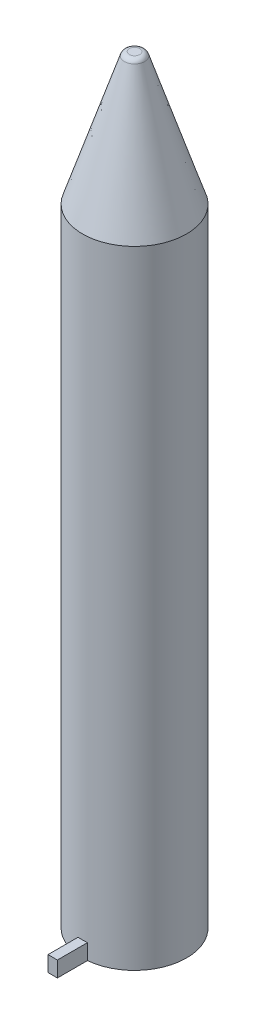
from build123d import *

# Parameters (mm, degrees)
SKETCH1_R           = 10
BOSS_EXTRUDE1_DEPTH = 120.65
BOSS_EXTRUDE2_DEPTH = 3
SKETCH4_R           = 8
CUT_EXTRUDE1_DEPTH  = 2.54


with BuildPart() as part:
    # Sketch1 → Boss-Extrude1 (new body)
    with BuildSketch(Plane(origin=(0, 0, 0), x_dir=(1, 0, 0), z_dir=(0, 1, 0))):
        Circle(SKETCH1_R)
    extrude(amount=BOSS_EXTRUDE1_DEPTH)

    # Sketch2 → Revolve1 (revolve)
    with BuildSketch(Plane.XY):
        with BuildLine():
            Line((0, 120.65), (0, 146.05))
            Line((0, 146.05), (1, 146.05))
            ThreePointArc((1, 146.05), (1.587481775, 145.859237397), (1.950824444, 145.359730328))
            Line((1.950824444, 145.359730328), (10, 120.65))
            Line((10, 120.65), (0, 120.65))
        make_face()
    revolve(axis=Axis((0, 120.65, 0), (0, 1, 0)))

    # Sketch3 → Boss-Extrude2 (add)
    with BuildSketch(Plane.XZ):
        with BuildLine():
            Line((-0.9, 15.75), (0.9, 15.75))
            Line((0.9, 15.75), (0.9, 9.354806465))
            ThreePointArc((0.9, 9.354806465), (0, 9.398), (-0.9, 9.354806465))
            Line((-0.9, 9.354806465), (-0.9, 15.75))
        make_face()
    extrude(amount=-BOSS_EXTRUDE2_DEPTH)

    # Sketch4 → Cut-Extrude1 (cut)
    with BuildSketch(Plane.XZ):
        Circle(SKETCH4_R)
    extrude(amount=-CUT_EXTRUDE1_DEPTH, mode=Mode.SUBTRACT)


solid = part.part
